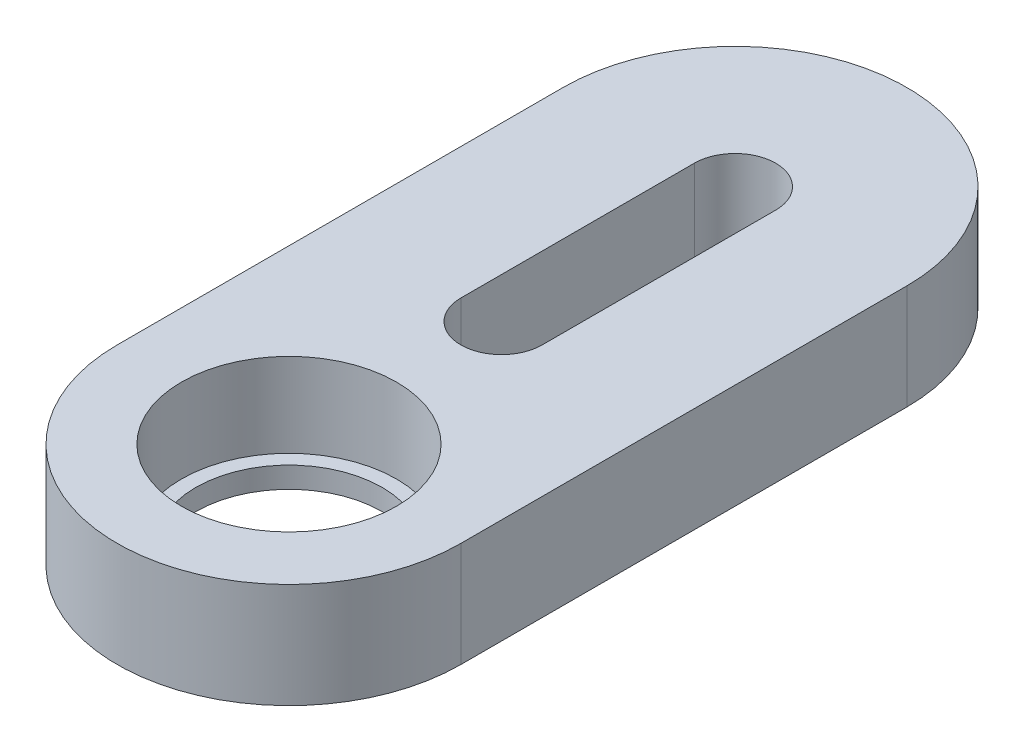
from build123d import *

# Parameters (mm, degrees)
SKETCH1_R           = 4.1
BOSS_EXTRUDE1_DEPTH = 4
SKETCH2_R           = 4.1
BOSS_EXTRUDE2_DEPTH = 0.8
SKETCH3_R           = 3.55
CUT_EXTRUDE1_DEPTH  = 25.652484662


with BuildPart() as part:
    # Sketch1 → Boss-Extrude1 (new body)
    with BuildSketch(Plane(origin=(0, 0, 0), x_dir=(1, 0, 0), z_dir=(0, 1, 0))):
        with BuildLine():
            ThreePointArc((-6.55, 0), (0, -6.55), (6.55, 0))
            Line((6.55, 0), (6.55, 17))
            ThreePointArc((6.55, 17), (0, 23.55), (-6.55, 17))
            Line((-6.55, 17), (-6.55, 0))
        make_face()
        Circle(SKETCH1_R, mode=Mode.SUBTRACT)
        with BuildLine():
            Line((-1.55, 8.1), (-1.55, 17))
            ThreePointArc((-1.55, 17), (0, 18.55), (1.55, 17))
            Line((1.55, 17), (1.55, 8.1))
            ThreePointArc((1.55, 8.1), (0, 6.55), (-1.55, 8.1))
        make_face(mode=Mode.SUBTRACT)
    extrude(amount=BOSS_EXTRUDE1_DEPTH)

    # Sketch2 → Boss-Extrude2 (add)
    with BuildSketch(Plane(origin=(0, 0, 0), x_dir=(1, 0, 0), z_dir=(0, 1, 0))):
        Circle(SKETCH2_R)
    extrude(amount=BOSS_EXTRUDE2_DEPTH)

    # Sketch3 → Cut-Extrude1 (cut, through all)
    with BuildSketch(Plane(origin=(0, 0.8, 0), x_dir=(1, 0, 0), z_dir=(0, 1, 0))):
        Circle(SKETCH3_R)
    extrude(amount=-CUT_EXTRUDE1_DEPTH, mode=Mode.SUBTRACT)


solid = part.part
